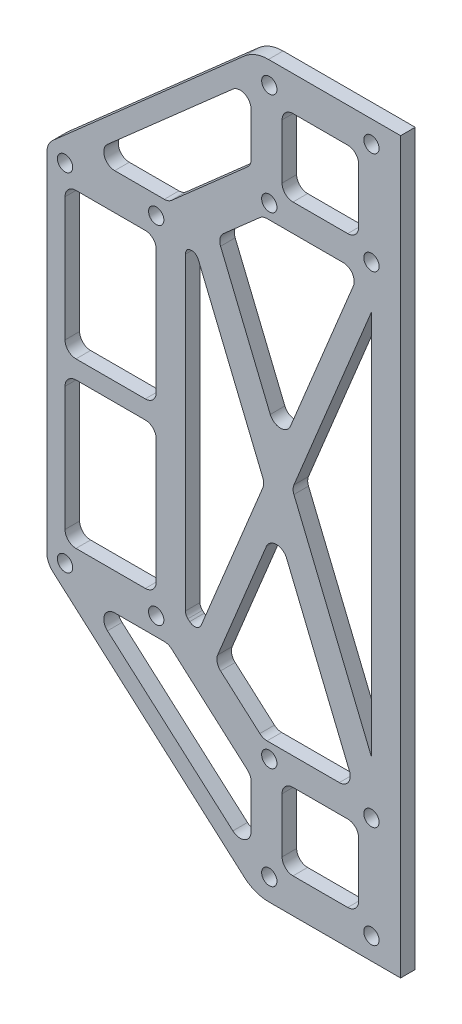
from build123d import *

# Parameters (mm, degrees)
SKETCH_1_R          = 2.1
EXTRUDE_1_DEPTH     = 4
CUT_EXTRUDE_2_DEPTH = 13
SKETCH_8_R          = 2.1
CUT_EXTRUDE_3_DEPTH = 4
SKETCH_9_W          = 4
SKETCH_9_H          = 200
EXTRUDE_4_DEPTH     = 4
FILLET_2_R          = 10
SKETCH_10_W         = 25
SKETCH_10_H         = 40
SKETCH_10_W_2       = 21
SKETCH_10_H_2       = 21
CUT_EXTRUDE_5_DEPTH = 13
FILLET_3_R          = 2
FILLET_4_R          = 3


with BuildPart() as part:
    # 草图1 → 凸台-拉伸1 (new body)
    with BuildSketch(Plane.XY):
        Polygon((-20, 100), (-77, 55), (-77, -55), (-20, -100), (20, -100), (20, 100), align=None)
        with Locations((-72, 47.5)):
            Circle(SKETCH_1_R, mode=Mode.SUBTRACT)
        with Locations((-47, 47.5)):
            Circle(SKETCH_1_R, mode=Mode.SUBTRACT)
        with Locations((-72, -47.5)):
            Circle(SKETCH_1_R, mode=Mode.SUBTRACT)
        with Locations((-47, -47.5)):
            Circle(SKETCH_1_R, mode=Mode.SUBTRACT)
        with Locations((-16, -66)):
            Circle(SKETCH_1_R, mode=Mode.SUBTRACT)
        with Locations((-16, -94)):
            Circle(SKETCH_1_R, mode=Mode.SUBTRACT)
        with Locations((-16, 94)):
            Circle(SKETCH_1_R, mode=Mode.SUBTRACT)
        with Locations((-16, 66)):
            Circle(SKETCH_1_R, mode=Mode.SUBTRACT)
    extrude(amount=EXTRUDE_1_DEPTH)

    # 草图6 → 切除-拉伸2 (cut)
    with BuildSketch(Plane(origin=(0, 0, 0), x_dir=(-1, 0, 0), z_dir=(0, 0, -1))):
        with BuildLine():
            Line((20, 100), (75.306183573, 51.250886586))
            ThreePointArc((75.306183573, 51.250886586), (76.556913312, 49.557800055), (77, 47.5))
            Line((77, 47.5), (77, 55))
            Line((77, 55), (20, 100))
        make_face()
        with BuildLine():
            Line((77, -55), (77, -47.5))
            ThreePointArc((77, -47.5), (76.556913312, -49.557800055), (75.306183573, -51.250886586))
            Line((75.306183573, -51.250886586), (20, -100))
            Line((20, -100), (77, -55))
        make_face()
    extrude(amount=-CUT_EXTRUDE_2_DEPTH, mode=Mode.SUBTRACT)

    # 草图8 → 切除-拉伸3 (cut)
    with BuildSketch(Plane.XY.offset(4)):
        with Locations((12, 94)):
            Circle(SKETCH_8_R)
        with Locations((12, 66)):
            Circle(SKETCH_8_R)
        with Locations((12, -66)):
            Circle(SKETCH_8_R)
        with Locations((12, -94)):
            Circle(SKETCH_8_R)
    extrude(amount=-CUT_EXTRUDE_3_DEPTH, mode=Mode.SUBTRACT)

    # 草图9 → 凸台-拉伸4 (add)
    with BuildSketch(Plane.XY.offset(4)):
        with Locations((18, 0)):
            Rectangle(SKETCH_9_W, SKETCH_9_H)
    extrude(amount=-EXTRUDE_4_DEPTH)

    # 圆角2
    fillet_2_edges = [part.edges().sort_by_distance(p)[0] for p in [
        (-20, 100, 2),
        (-20, -100, 2),
    ]]
    fillet(fillet_2_edges, radius=FILLET_2_R)

    # 草图10 → 切除-拉伸5 (cut)
    with BuildSketch(Plane.XY.offset(4)):
        Polygon((8.756169307, 62), (-17.741713503, 62), (-30.169479576, 51.045662914), (-12.959361551, 9.201454384), align=None)
        Polygon((-17.284469142, -1.314493483), (-36.518131022, 45.449704029), (-39, 43.262084048), (-39, -43.262084048), (-35.724549591, -46.14919889), align=None)
        Polygon((12, 54.113039099), (-9.715530858, 1.314493483), (12, -51.484052132), align=None)
        Polygon((7.674892409, -62), (-14.040638449, -9.201454384), (-30.963061007, -50.346168054), (-17.741713503, -62), align=None)
        with Locations((-59.5, -22.5)):
            Rectangle(SKETCH_10_W, SKETCH_10_H)
        with Locations((-59.5, 22.5)):
            Rectangle(SKETCH_10_W, SKETCH_10_H)
        Polygon((-43.642701965, 52.5), (-21, 72.458195897), (-21, 92.453468554), (-66.327467753, 52.5), align=None)
        with Locations((-2, 80)):
            Rectangle(SKETCH_10_W_2, SKETCH_10_H_2)
        Polygon((-21, -72.458195897), (-21, -92.453468554), (-66.327467753, -52.5), (-43.642701965, -52.5), align=None)
        with Locations((-2, -80)):
            Rectangle(SKETCH_10_W_2, SKETCH_10_H_2)
    extrude(amount=-CUT_EXTRUDE_5_DEPTH, mode=Mode.SUBTRACT)

    # 圆角3
    # the kernel refuses this fillet: 2 mm, written as the material it adds along each edge
    with BuildSketch(Plane(origin=(-35.724549591, -46.14919889, 4), x_dir=(0.3803746509932158, 0.9248324847678034, 0), z_dir=(0, 0, -1))) as fillet_3_piece_1:
        with BuildLine():
            CenterArc((FILLET_3_R * 1.4029157826, -FILLET_3_R), FILLET_3_R, 90, 109.037368678)
            Line((FILLET_3_R * 0.457609745735, -FILLET_3_R * 1.3261847585), (0, 0))
            Line((0, 0), (FILLET_3_R * 1.4029157826, 0))
        make_face()
    extrude(amount=4)
    with BuildSketch(Plane(origin=(-39, -43.262084048, 4), x_dir=(0, 1, 0), z_dir=(0, 0, -1)), Plane(origin=(-39, 43.262084048, 4), x_dir=(0.7501773172639279, 0.6612367145453253, 0), z_dir=(0, 0, -1))) as fillet_3_piece_2:
        with BuildLine():
            CenterArc((FILLET_3_R * 0.451577617263, FILLET_3_R), FILLET_3_R, 221.394260007, 48.605739993)
            Line((-FILLET_3_R * 0.298599700001, FILLET_3_R * 0.338763285455), (0, 0))
            Line((0, 0), (FILLET_3_R * 0.451577617263, 0))
        make_face()
    extrude(amount=4)
    with BuildSketch(Plane(origin=(-36.518131022, 45.449704029, 4), x_dir=(0.3803746509932163, -0.9248324847678032, 0), z_dir=(0, 0, -1))) as fillet_3_piece_3:
        with BuildLine():
            CenterArc((FILLET_3_R * 1.4029157826, FILLET_3_R), FILLET_3_R, 160.962631322, 109.037368678)
            Line((FILLET_3_R * 0.457609745735, FILLET_3_R * 1.3261847585), (0, 0))
            Line((0, 0), (FILLET_3_R * 1.4029157826, 0))
        make_face()
    extrude(amount=4)

    # 圆角4
    fillet_4_edges = [part.edges().sort_by_distance(p)[0] for p in [
        (-47, 2.5, 2),
        (-72, 2.5, 2),
        (-72, 42.5, 2),
        (-47, 42.5, 2),
        (-21, 72.458195897, 2),
        (-43.642701965, 52.5, 2),
        (-66.327467753, 52.5, 2),
        (-21, 92.453468554, 2),
        (8.5, 69.5, 2),
        (-12.5, 69.5, 2),
        (-12.5, 90.5, 2),
        (8.5, 90.5, 2),
        (-21, -72.458195897, 2),
        (-21, -92.453468554, 2),
        (-66.327467753, -52.5, 2),
        (-43.642701965, -52.5, 2),
        (-17.284469142, -1.314493483, 2),
        (-9.715530858, 1.314493483, 2),
        (-14.040638449, -9.201454384, 2),
        (7.674892409, -62, 2),
        (-17.741713503, -62, 2),
        (-30.963061007, -50.346168054, 2),
        (-47, -42.5, 2),
        (-72, -42.5, 2),
        (-72, -2.5, 2),
        (-47, -2.5, 2),
        (-12.5, -69.5, 2),
        (8.5, -69.5, 2),
        (8.5, -90.5, 2),
        (-12.5, -90.5, 2),
        (8.756169307, 62, 2),
        (-12.959361551, 9.201454384, 2),
        (-30.169479576, 51.045662914, 2),
        (-17.741713503, 62, 2),
    ]]
    fillet(fillet_4_edges, radius=FILLET_4_R)


solid = part.part
